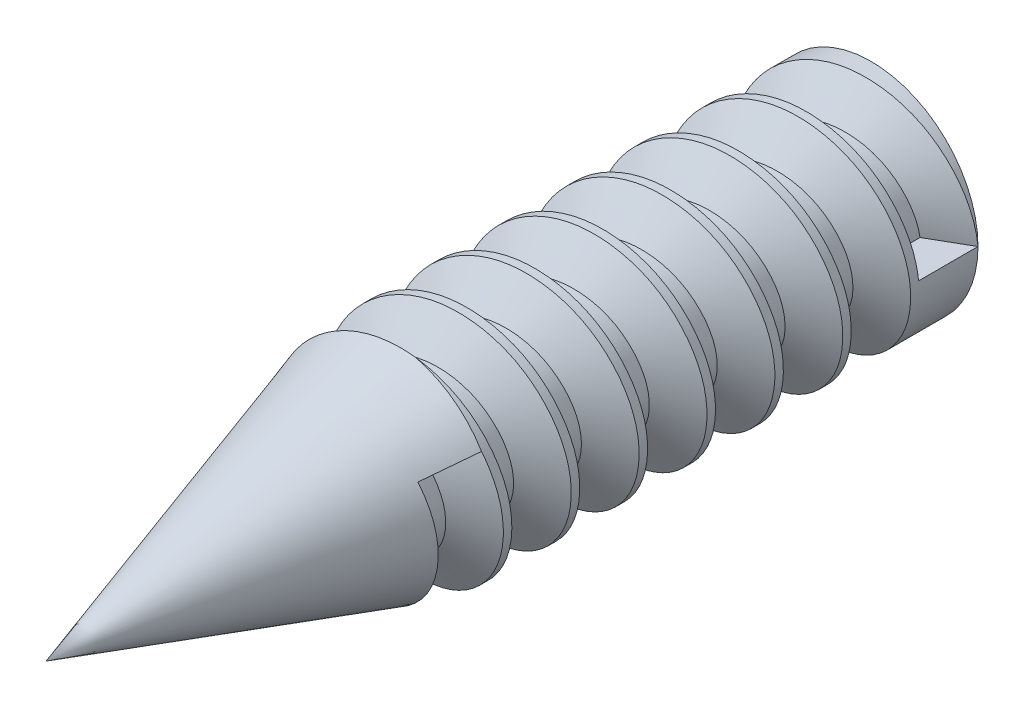
from build123d import *

# Parameters (mm, degrees)
SKETCH_1_R      = 2
EXTRUDE_1_DEPTH = 9
THREAD_1_PITCH  = 1.27


with BuildPart() as part:
    # Sketch 1 → 凸台-拉伸1 (new body)
    with BuildSketch(Plane.XY):
        Circle(SKETCH_1_R)
    extrude(amount=EXTRUDE_1_DEPTH)

    # 草图2 → 旋转1 (revolve)
    with BuildSketch(Plane(origin=(0, 0, 0), x_dir=(0, 0, -1), z_dir=(1, 0, 0)), mode=Mode.PRIVATE) as revolve_1_sk:
        Polygon((-9, 0), (-15.437732407, 0), (-9, 2), align=None)
    revolve(revolve_1_sk.sketch.rotate(Axis((0, 0, 9), (0, 0, 1)), 90), axis=Axis((0, 0, 9), (0, 0, 1)))

    # 螺纹线1: the profile of Sketch 1 2 profile screwed along a right-hand helix of 7.086614 turns, 8 arcs to a turn; built about Z, then put on its axis
    thread_1_z = Axis((0, 0, 0), (0, 0, 1))
    thread_1_corners = [(2.0003, 0, -0.000173205), (2.0003, 0, 1.111423202), (1.312592339, 0, 0.714374998), (1.312592339, 0, 0.396874998)]
    with BuildLine(mode=Mode.PRIVATE) as thread_1_profile:
        Line(thread_1_corners[0], thread_1_corners[1])
        Line(thread_1_corners[1], thread_1_corners[2])
        Line(thread_1_corners[2], thread_1_corners[3])
        Line(thread_1_corners[3], thread_1_corners[0])
    thread_1_cap = Face(thread_1_profile.wire())
    thread_1_turn_angles = [0, 22.5, 45, 67.5, 90, 112.5, 135, 157.5, 180, 202.5, 225, 247.5, 270, 292.5, 315, 337.5, 360]
    thread_1_turn_weights = [1, 0.9238795325112867, 1, 0.9238795325112867, 1, 0.9238795325112867, 1, 0.9238795325112867, 1, 0.9238795325112867, 1, 0.9238795325112867, 1, 0.9238795325112867, 1, 0.9238795325112867, 1]
    thread_1_turn_rails = [Edge.make_bspline([Vector(p[0], p[1], 0).rotate(thread_1_z, thread_1_turn_angles[k]) / thread_1_turn_weights[k] + Vector(0, 0, p[2] + THREAD_1_PITCH * thread_1_turn_angles[k] / 360) for k in range(17)], [0, 0, 0, 1, 1, 2, 2, 3, 3, 4, 4, 5, 5, 6, 6, 7, 7, 8, 8, 8], 2, thread_1_turn_weights) for p in thread_1_corners]
    thread_1_turn_sides = [Face.make_surface_from_curves(thread_1_turn_rails[p[0]], thread_1_turn_rails[p[1]]) for p in [(0, 1), (1, 2), (2, 3), (3, 0)]]
    thread_1_last_angles = [2520, 2535.590551181, 2551.181102362]
    thread_1_last_weights = [1, 0.9632069020746566, 1]
    thread_1_last_rails = [Edge.make_bspline([Vector(p[0], p[1], 0).rotate(thread_1_z, thread_1_last_angles[k]) / thread_1_last_weights[k] + Vector(0, 0, p[2] + THREAD_1_PITCH * thread_1_last_angles[k] / 360) for k in range(3)], [0, 0, 0, 1, 1, 1], 2, thread_1_last_weights) for p in thread_1_corners]
    thread_1_last_sides = [Face.make_surface_from_curves(thread_1_last_rails[p[0]], thread_1_last_rails[p[1]]) for p in [(0, 1), (1, 2), (2, 3), (3, 0)]]
    thread_1 = Plane(origin=(0, 0, 0), x_dir=(1, 0, 0), z_dir=(0, 0, 1)) * Solid(Shell([*[p.moved(Location((0, 0, THREAD_1_PITCH * i))) for i in range(7) for p in thread_1_turn_sides], *thread_1_last_sides, thread_1_cap, thread_1_cap.rotate(thread_1_z, 2551.181102362).moved(Location((0, 0, THREAD_1_PITCH * 2551.181102362 / 360)))]))
    add(thread_1, mode=Mode.SUBTRACT)


solid = part.part
